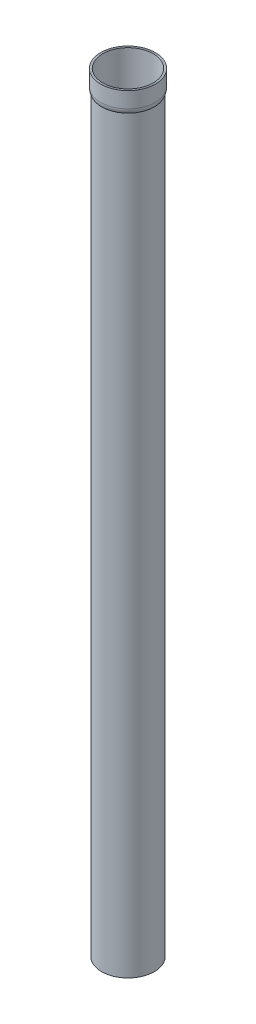
from build123d import *

# Parameters (mm, degrees)
ESBO_O1_R                = 26
ESBO_O1_R_2              = 25
RESSALTO_EXTRUS_O1_DEPTH = 760
ESBO_O2_R                = 27
ESBO_O2_R_2              = 26
RESSALTO_EXTRUS_O2_DEPTH = 20
FILETE2_R                = 10


with BuildPart() as part:
    # Esboço1 → Ressalto-extrusão1 (new body)
    with BuildSketch(Plane(origin=(0, 0, 0), x_dir=(1, 0, 0), z_dir=(0, 1, 0))):
        with Locations(Location((0, 0, 0), (0, 0, 270))):
            Circle(ESBO_O1_R)
        with Locations(Location((0, 0, 0), (0, 0, 270))):
            Circle(ESBO_O1_R_2, mode=Mode.SUBTRACT)
    extrude(amount=RESSALTO_EXTRUS_O1_DEPTH)


with BuildPart() as body_2:
    # Esboço2 → Ressalto-extrusão2 (new body)
    with BuildSketch(Plane(origin=(0, 760, 0), x_dir=(1, 0, 0), z_dir=(0, 1, 0))):
        with Locations(Location((0, 0, 0), (0, 0, 270))):
            Circle(ESBO_O2_R)
        with Locations(Location((0, 0, 0), (0, 0, 270))):
            Circle(ESBO_O2_R_2, mode=Mode.SUBTRACT)
    extrude(amount=-RESSALTO_EXTRUS_O2_DEPTH)

    # Filete2
    # the kernel refuses this fillet: 10 mm, written as the material it takes off along each edge
    with BuildSketch(Plane(origin=(0, 740, 0), x_dir=(0, 0, 1), z_dir=(-1, 0, 0))) as filete2_piece_1:
        with BuildLine():
            CenterArc((17, 4.358898944), FILETE2_R, 334.158067237, 25.841932763)
            Line((26, 0), (26.18, -0.087177979))
            ThreePointArc((26.18, -0.087177979), (26.5, -0.2), (27, -0.2))
            Line((27, -0.2), (27.2, 0))
            Line((27.2, 0), (27.2, 4.358898944))
            Line((27.2, 4.358898944), (27, 4.358898944))
        make_face()
    revolve(axis=Axis((0, 740, 0), (0, 1, 0)), mode=Mode.SUBTRACT)


solid = Compound([part.part, body_2.part])
